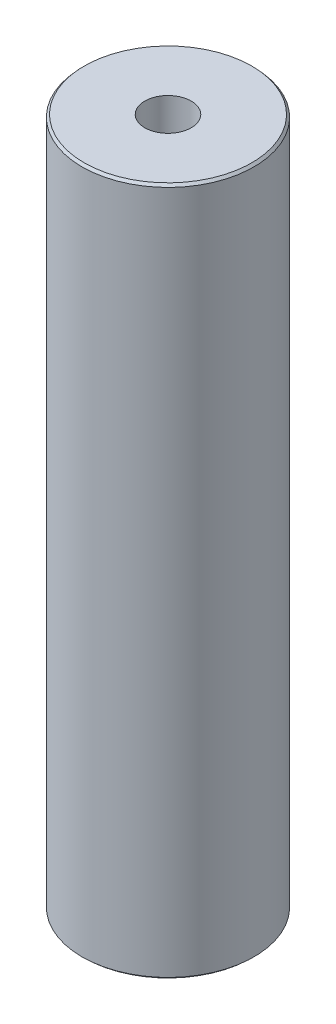
from build123d import *
from OCP.BRepFilletAPI import BRepFilletAPI_MakeChamfer

# Parameters (mm, degrees)
SKETCH1_R           = 10
BOSS_EXTRUDE1_DEPTH = 80.077415841
SKETCH2_R           = 2.697247897
CUT_EXTRUDE1_DEPTH  = 82.316619014
CHAMFER1_SIZE       = 0.282320205
CHAMFER1_SIZE2      = 0.254884933


with BuildPart() as part:
    # Sketch1 → Boss-Extrude1 (new body)
    with BuildSketch(Plane(origin=(0, 0, 0), x_dir=(1, 0, 0), z_dir=(0, 1, 0))):
        Circle(SKETCH1_R)
    extrude(amount=BOSS_EXTRUDE1_DEPTH)

    # Sketch2 → Cut-Extrude1 (cut, through all)
    with BuildSketch(Plane(origin=(0, 0, 0), x_dir=(1, 0, 0), z_dir=(0, 1, 0))):
        Circle(SKETCH2_R)
    extrude(amount=CUT_EXTRUDE1_DEPTH, mode=Mode.SUBTRACT)

    # Chamfer1: one chamfer whose edges measure the first distance from different faces: ONE call of the kernel's chamfer builder (chamfer() names one face for all edges)
    chamfer1_edges_1 = [part.edges().sort_by_distance(p)[0] for p in [
        (-10, 80.077415841, 0),
    ]]
    chamfer1_side_1 = [part.faces().sort_by_distance(p)[0] for p in [
        (-10, 40.038707921, 0),
    ]]
    chamfer1_edges_2 = [part.edges().sort_by_distance(p)[0] for p in [
        (-10, 0, 0),
    ]]
    chamfer1_side_2 = [part.faces().sort_by_distance(p)[0] for p in [
        (-9.717157288, 0, 0),
    ]]
    chamfer1 = BRepFilletAPI_MakeChamfer(part.part.solid().wrapped)
    for e in chamfer1_edges_1:
        chamfer1.Add(CHAMFER1_SIZE, CHAMFER1_SIZE2, e.wrapped, chamfer1_side_1[0].wrapped)  # the first distance lies on this face
    for e in chamfer1_edges_2:
        chamfer1.Add(CHAMFER1_SIZE, CHAMFER1_SIZE2, e.wrapped, chamfer1_side_2[0].wrapped)  # the first distance lies on this face
    add(Compound.cast(chamfer1.Shape()), mode=Mode.REPLACE)


solid = part.part
